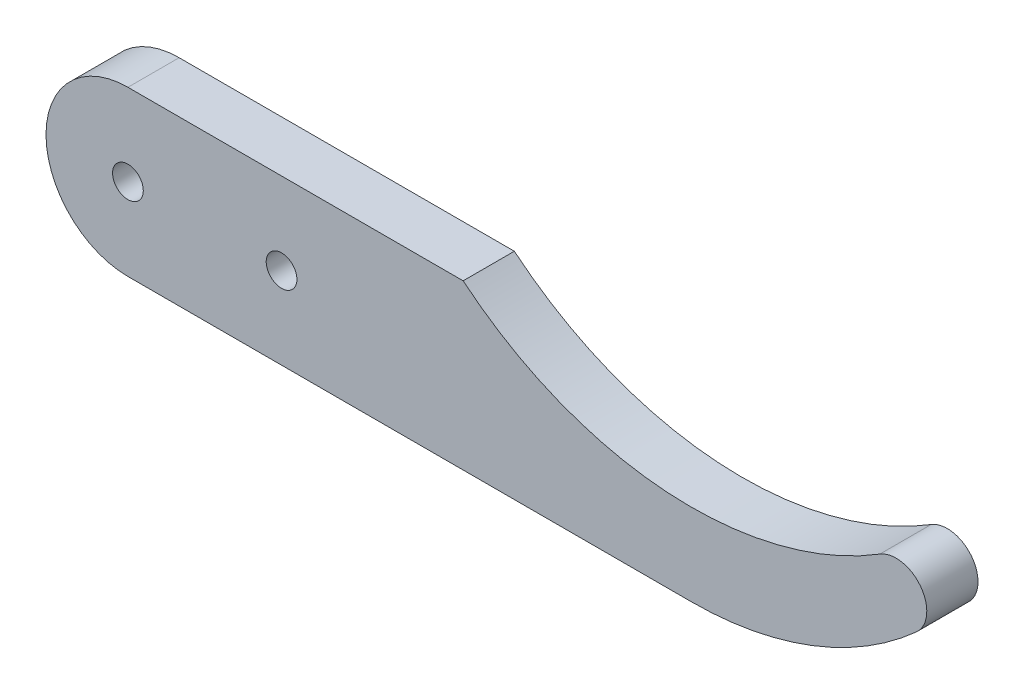
from build123d import *

# Parameters (mm, degrees)
ESQUISSE1_R        = 1.5
BOSS_EXTRU_1_DEPTH = 5


with BuildPart() as part:
    # Esquisse1 → Boss.-Extru.1 (new body)
    with BuildSketch(Plane.XY):
        with BuildLine():
            Line((0, 8), (17.728942549, 8))
            ThreePointArc((17.728942549, 8), (37.631413569, 0.080237711), (58.421052632, 5.239878697))
            ThreePointArc((58.421052632, 5.239878697), (62.398811391, 4.49059488), (62.009669683, 0.461629788))
            ThreePointArc((62.009669683, 0.461629788), (51.790088403, -5.811719694), (40, -8))
            Line((40, -8), (0, -8))
            Line((0, -8), (-15, -8))
            ThreePointArc((-15, -8), (-23, 0), (-15, 8))
            Line((-15, 8), (0, 8))
        make_face()
        Circle(ESQUISSE1_R, mode=Mode.SUBTRACT)
        with Locations((-15, 0)):
            Circle(ESQUISSE1_R, mode=Mode.SUBTRACT)
    extrude(amount=BOSS_EXTRU_1_DEPTH)


solid = part.part
